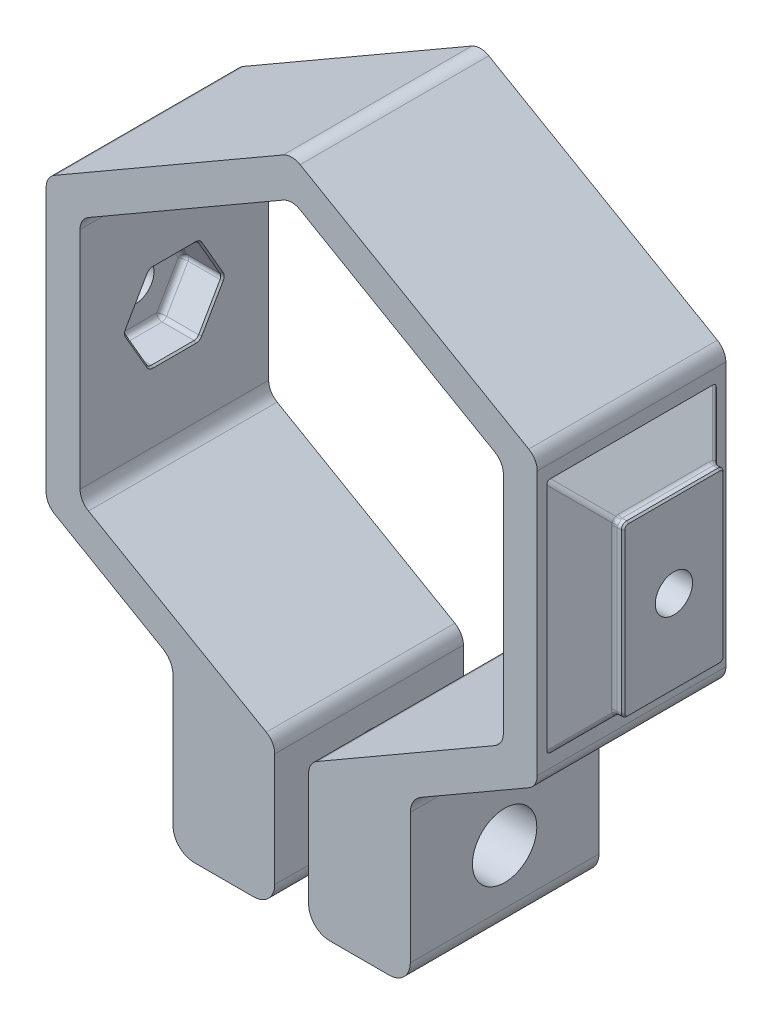
from build123d import *

# Parameters (mm, degrees)
BOSS_EXTRUDE9_DEPTH      = 14.13764
SKETCH17_W               = 7.62
SKETCH17_H               = 12.7
BOSS_EXTRUDE10_DEPTH     = 3.175
CHAMFER1_SIZE            = 2.54
SKETCH18_W               = 7.62
SKETCH18_H               = 12.7
BOSS_EXTRUDE11_DEPTH     = 3.175
CHAMFER2_SIZE            = 2.54
CUT_EXTRUDE12_REACH      = 52.138
SKETCH19_R               = 1.397
CUT_EXTRUDE13_REACH      = 52.138
SKETCH20_R               = 1.397
CUT_EXTRUDE15_DEPTH      = 2.921
CUT_EXTRUDE16_START      = 31.725837
CUT_EXTRUDE16_DEPTH      = 2.921
BOSS_EXTRUDE12_DEPTH     = 14.13764
CUT_EXTRUDE17_DEPTH      = 39.356838538
CUT_EXTRUDE17_DEPTH_BACK = 39.356838538
SKETCH26_W               = 2.54
SKETCH26_H               = 15.24
CUT_EXTRUDE18_DEPTH      = 44.976522753
CUT_EXTRUDE18_DEPTH_BACK = 44.976522753
SKETCH27_R               = 2.413
FILLET1_R                = 1.27
FILLET4_R                = 1.27
FILLET8_R                = 1.5875
FILLET9_R                = 0.396875
FILLET10_R               = 0.396875
CHAMFER4_SIZE            = 0.127


with BuildPart() as part:
    # Sketch1 → Boss-Extrude9 (new body)
    with BuildSketch(Plane.XY):
        Polygon((0, 21.249859888), (-18.40291849, 10.624929944), (-18.40291849, -10.624929944), (0, -21.249859888), (18.40291849, -10.624929944), (18.40291849, 10.624929944), align=None)
        Polygon((0, 18.316920521), (-15.86291849, 9.15846026), (-15.86291849, -9.15846026), (0, -18.316920521), (15.86291849, -9.15846026), (15.86291849, 9.15846026), align=None, mode=Mode.SUBTRACT)
    extrude(amount=BOSS_EXTRUDE9_DEPTH)

    # Sketch17 → Boss-Extrude10 (add)
    with BuildSketch(Plane.ZY.offset(18.40291849)):
        with Locations((7.06882, 0)):
            Rectangle(SKETCH17_W, SKETCH17_H)
    extrude(amount=BOSS_EXTRUDE10_DEPTH)

    # Chamfer1
    chamfer1_edges = [part.edges().sort_by_distance(p)[0] for p in [
        (-18.40291849, 0, 10.87882),
        (-18.40291849, 6.35, 7.06882),
        (-18.40291849, 0, 3.25882),
        (-18.40291849, -6.35, 7.06882),
    ]]
    chamfer(chamfer1_edges, length=CHAMFER1_SIZE)

    # Sketch18 → Boss-Extrude11 (add)
    with BuildSketch(Plane(origin=(18.40291849, 0, 0), x_dir=(0, 0, -1), z_dir=(1, 0, 0))):
        with Locations((-7.06882, 0)):
            Rectangle(SKETCH18_W, SKETCH18_H)
    extrude(amount=BOSS_EXTRUDE11_DEPTH)

    # Chamfer2
    chamfer2_edges = [part.edges().sort_by_distance(p)[0] for p in [
        (18.40291849, 0, 3.25882),
        (18.40291849, 6.35, 7.06882),
        (18.40291849, 0, 10.87882),
        (18.40291849, -6.35, 7.06882),
    ]]
    chamfer(chamfer2_edges, length=CHAMFER2_SIZE)

    # Sketch19 → Cut-Extrude12 (cut, up to next)
    with BuildSketch(Plane(origin=(21.57791849, 0, 0), x_dir=(0, 0, -1), z_dir=(1, 0, 0)), mode=Mode.PRIVATE) as cut_extrude12_sk1:
        with Locations(Location((-7.06882, 0, 0), (0, 0, 90))):
            Circle(SKETCH19_R)
    cut_extrude12_tool1 = extrude(cut_extrude12_sk1.sketch, amount=-CUT_EXTRUDE12_REACH, mode=Mode.PRIVATE) & part.part
    add(cut_extrude12_tool1.solids().sort_by_distance((21.577918, 0, 7.06882))[0], mode=Mode.SUBTRACT)

    # Sketch20 → Cut-Extrude13 (cut, up to next)
    with BuildSketch(Plane.ZY.offset(21.57791849), mode=Mode.PRIVATE) as cut_extrude13_sk1:
        with Locations(Location((7.06882, 0, 0), (0, 0, 90))):
            Circle(SKETCH20_R)
    cut_extrude13_tool1 = extrude(cut_extrude13_sk1.sketch, amount=-CUT_EXTRUDE13_REACH, mode=Mode.PRIVATE) & part.part
    add(cut_extrude13_tool1.solids().sort_by_distance((-21.577918, 0, 7.06882))[0], mode=Mode.SUBTRACT)

    # Sketch25 → Cut-Extrude15 (cut)
    with BuildSketch(Plane(origin=(-15.86291849, 0, 0), x_dir=(0, 0, -1), z_dir=(1, 0, 0))):
        Polygon((-5.235732895, 3.175), (-8.901907105, 3.175), (-10.734994209, 0), (-8.901907105, -3.175), (-5.235732895, -3.175), (-3.402645791, 0), align=None)
    extrude(amount=-CUT_EXTRUDE15_DEPTH, mode=Mode.SUBTRACT)

    # Sketch25<2> → Cut-Extrude16 (cut)
    with BuildSketch(Plane(origin=(-15.86291849, 0, 0), x_dir=(0, 0, -1), z_dir=(1, 0, 0)).offset(CUT_EXTRUDE16_START)):
        Polygon((-5.235732895, 3.175), (-8.901907105, 3.175), (-10.734994209, 0), (-8.901907105, -3.175), (-5.235732895, -3.175), (-3.402645791, 0), align=None)
    extrude(amount=CUT_EXTRUDE16_DEPTH, mode=Mode.SUBTRACT)

    # Sketch21 → Boss-Extrude12 (add)
    with BuildSketch(Plane.XY.offset(14.13764)):
        Polygon((-8.89, -16.117215995), (-8.89, -28.386046423), (8.89, -28.386046423), (8.89, -16.117215995), (0, -21.249859888), align=None)
    extrude(amount=-BOSS_EXTRUDE12_DEPTH)

    # Sketch26 → Cut-Extrude17 (cut, two sides: drawn at the far end of the back side and taken through both)
    with BuildSketch(Plane.XY.offset(14.13764).offset(-CUT_EXTRUDE17_DEPTH_BACK)):
        with Locations((0, -24.08969824)):
            Rectangle(SKETCH26_W, SKETCH26_H)
    extrude(amount=CUT_EXTRUDE17_DEPTH + CUT_EXTRUDE17_DEPTH_BACK, mode=Mode.SUBTRACT)

    # Sketch27 → Cut-Extrude18 (cut, two sides: drawn at the far end of the back side and taken through both)
    with BuildSketch(Plane(origin=(8.89, 0, 0), x_dir=(0, 0, -1), z_dir=(1, 0, 0)).offset(-CUT_EXTRUDE18_DEPTH_BACK)):
        with Locations(Location((-7.06882, -22.709902985, 0), (0, 0, 90))):
            Circle(SKETCH27_R)
    extrude(amount=CUT_EXTRUDE18_DEPTH + CUT_EXTRUDE18_DEPTH_BACK, mode=Mode.SUBTRACT)

    # Fillet1
    fillet1_edges = [part.edges().sort_by_distance(p)[0] for p in [
        (-1.27, -17.583685679, 7.06882),
        (1.27, -17.583685679, 7.06882),
        (0, 18.316920521, 7.06882),
        (-15.86291849, 9.15846026, 7.06882),
        (-15.86291849, -9.15846026, 7.06882),
        (15.86291849, -9.15846026, 7.06882),
        (15.86291849, 9.15846026, 7.06882),
    ]]
    fillet(fillet1_edges, radius=FILLET1_R)

    # Fillet4
    fillet4_edges = [part.edges().sort_by_distance(p)[0] for p in [
        (18.40291849, -10.624929944, 7.06882),
        (-18.40291849, -10.624929944, 7.06882),
        (-18.40291849, 10.624929944, 7.06882),
        (0, 21.249859888, 7.06882),
        (18.40291849, 10.624929944, 7.06882),
    ]]
    fillet(fillet4_edges, radius=FILLET4_R)

    # Fillet8
    fillet8_edges = [part.edges().sort_by_distance(p)[0] for p in [
        (-8.89, -16.117215995, 7.06882),
        (8.89, -16.117215995, 7.06882),
        (8.89, -28.386046423, 7.06882),
        (-8.89, -28.386046423, 7.06882),
        (1.27, -28.386046423, 7.06882),
        (-1.27, -28.386046423, 7.06882),
    ]]
    fillet(fillet8_edges, radius=FILLET8_R)

    # Fillet9
    fillet9_edges = [part.edges().sort_by_distance(p)[0] for p in [
        (-18.78391849, 1.5875, 4.319189343),
        (-17.32341849, 3.175, 5.235732895),
        (-18.78391849, -1.5875, 4.319189343),
        (-17.32341849, 0, 3.402645791),
        (-18.78391849, -3.175, 7.06882),
        (-17.32341849, -3.175, 5.235732895),
        (-18.78391849, -1.5875, 9.818450657),
        (-17.32341849, -3.175, 8.901907105),
        (-18.78391849, 1.5875, 9.818450657),
        (-17.32341849, 0, 10.734994209),
        (-18.78391849, 3.175, 7.06882),
        (-17.32341849, 3.175, 8.901907105),
        (18.78391851, 1.5875, 4.319189343),
        (18.78391851, 3.175, 7.06882),
        (18.78391851, 1.5875, 9.818450657),
        (18.78391851, -1.5875, 9.818450657),
        (18.78391851, -3.175, 7.06882),
        (18.78391851, -1.5875, 4.319189343),
        (17.32341851, 0, 3.402645791),
        (17.32341851, 3.175, 5.235732895),
        (17.32341851, 3.175, 8.901907105),
        (17.32341851, 0, 10.734994209),
        (17.32341851, -3.175, 8.901907105),
        (17.32341851, -3.175, 5.235732895),
        (-21.26041849, -6.35, 10.87882),
        (-21.26041849, 6.35, 10.87882),
        (-21.26041849, 6.35, 3.25882),
        (-21.26041849, -6.35, 3.25882),
        (21.26041849, -6.35, 3.25882),
        (21.26041849, 6.35, 3.25882),
        (21.26041849, 6.35, 10.87882),
        (21.26041849, -6.35, 10.87882),
    ]]
    fillet(fillet9_edges, radius=FILLET9_R)

    # Fillet10
    fillet10_edges = [part.edges().sort_by_distance(p)[0] for p in [
        (20.94291849, 0, 3.25882),
        (20.94291849, -6.35, 7.06882),
        (20.94291849, 0, 10.87882),
        (20.94291849, 6.35, 7.06882),
        (-20.94291849, 0, 10.87882),
        (-20.94291849, -6.35, 7.06882),
        (-20.94291849, 0, 3.25882),
        (-20.94291849, 6.35, 7.06882),
        (20.976571276, -6.113060578, 3.292472786),
        (20.976571276, -6.316347214, 3.495759422),
        (20.976571276, -6.316347214, 10.641880578),
        (20.976571276, -6.113060578, 10.845167214),
        (20.976571276, 6.316347214, 3.495759422),
        (20.976571276, 6.113060578, 3.292472786),
        (20.976571276, 6.113060578, 10.845167214),
        (20.976571276, 6.316347214, 10.641880578),
        (-20.976571276, -6.113060578, 10.845167214),
        (-20.976571276, -6.316347214, 10.641880578),
        (-20.976571276, -6.316347214, 3.495759422),
        (-20.976571276, -6.113060578, 3.292472786),
        (-20.976571276, 6.113060578, 3.292472786),
        (-20.976571276, 6.316347214, 3.495759422),
        (-20.976571276, 6.316347214, 10.641880578),
        (-20.976571276, 6.113060578, 10.845167214),
        (-19.731039488, 7.561879002, 2.046940998),
        (-19.731039488, 7.561879002, 12.090699002),
        (-19.731039488, -7.561879002, 2.046940998),
        (-19.731039488, -7.561879002, 12.090699002),
        (19.731039488, 7.561879002, 12.090699002),
        (19.731039488, 7.561879002, 2.046940998),
        (19.731039488, -7.561879002, 12.090699002),
        (19.731039488, -7.561879002, 2.046940998),
    ]]
    fillet(fillet10_edges, radius=FILLET10_R)

    # Chamfer4
    chamfer4_edges = [part.edges().sort_by_distance(p)[0] for p in [
        (21.57791849, 0, 3.25882),
        (21.57791849, -6.35, 7.06882),
        (21.57791849, 6.35, 7.06882),
        (21.57791849, 0, 10.87882),
        (21.57791849, 6.233758004, 10.762578004),
        (21.57791849, 6.233758004, 3.375061996),
        (21.57791849, -6.233758004, 10.762578004),
        (21.57791849, -6.233758004, 3.375061996),
        (-21.57791849, 0, 10.87882),
        (-21.57791849, -6.35, 7.06882),
        (-21.57791849, 6.35, 7.06882),
        (-21.57791849, 0, 3.25882),
        (-21.57791849, 6.233758004, 10.762578004),
        (-21.57791849, 6.233758004, 3.375061996),
        (-21.57791849, -6.233758004, 3.375061996),
        (-21.57791849, -6.233758004, 10.762578004),
        (-15.86291849, -1.5875, 4.319189343),
        (-15.86291849, -3.175, 7.06882),
        (-15.86291849, -1.5875, 9.818450657),
        (-15.86291849, 1.5875, 9.818450657),
        (-15.86291849, 3.175, 7.06882),
        (-15.86291849, 1.5875, 4.319189343),
        (15.86291851, 1.5875, 4.319189343),
        (15.86291851, 3.175, 7.06882),
        (15.86291851, 1.5875, 9.818450657),
        (15.86291851, -1.5875, 9.818450657),
        (15.86291851, -3.175, 7.06882),
        (15.86291851, -1.5875, 4.319189343),
        (-15.86291849, -3.121828832, 5.266431283),
        (-15.86291849, -3.121828832, 8.871208717),
        (-15.86291849, 0, 10.673597433),
        (-15.86291849, 3.121828832, 8.871208717),
        (-15.86291849, 3.121828832, 5.266431283),
        (-15.86291849, 0, 3.464042567),
        (15.86291849, 3.121828832, 5.266431283),
        (15.86291849, 3.121828832, 8.871208717),
        (15.86291849, 0, 10.673597433),
        (15.86291849, -3.121828832, 8.871208717),
        (15.86291849, -3.121828832, 5.266431283),
        (15.86291849, 0, 3.464042567),
    ]]
    chamfer(chamfer4_edges, length=CHAMFER4_SIZE)


solid = part.part
